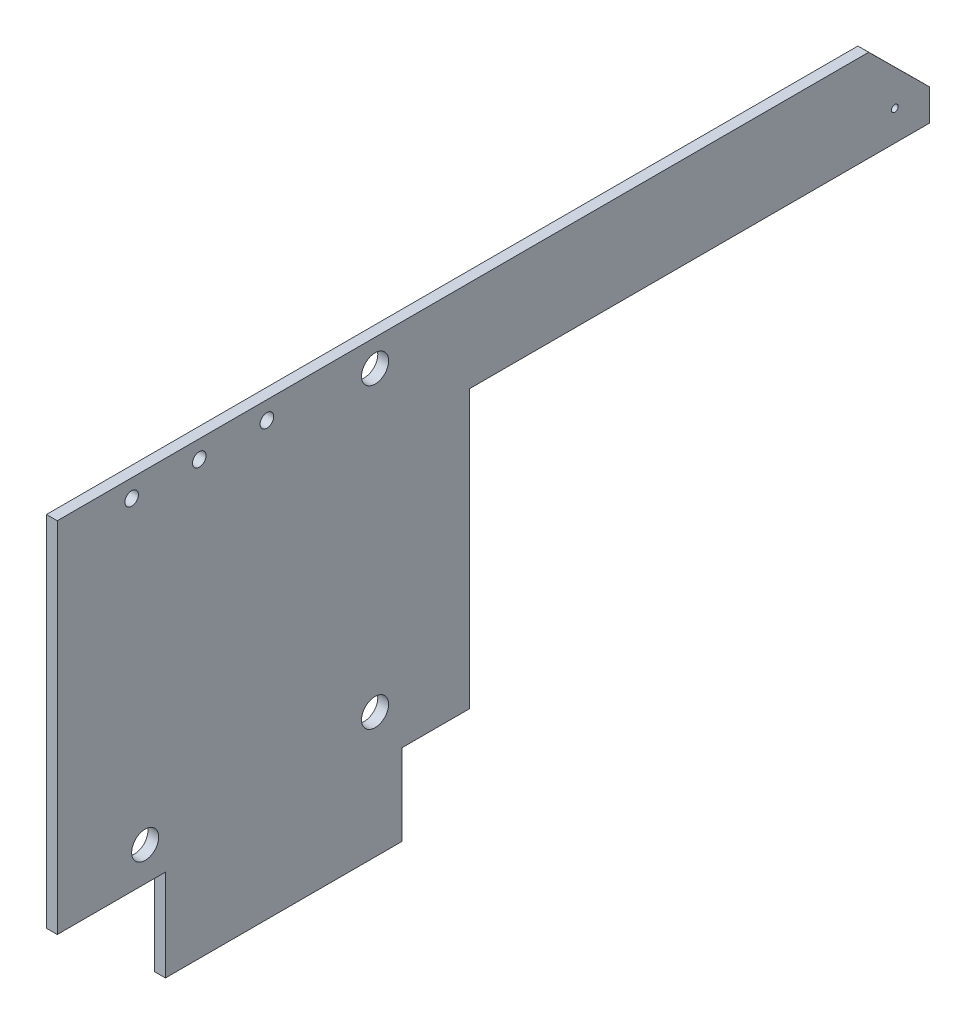
from build123d import *

# Parameters (mm, degrees)
SKETCH1_R           = 2
SKETCH1_R_2         = 1
SKETCH1_R_3         = 0.5
BOSS_EXTRUDE1_DEPTH = 1.6


with BuildPart() as part:
    # Sketch1 → Boss-Extrude1 (new body)
    with BuildSketch(Plane(origin=(0, 0, 0), x_dir=(0, 0, -1), z_dir=(1, 0, 0))):
        Polygon((3, 11), (3, 64), (123, 64), (132, 55.063430305), (132, 50.423430305), (64, 50.423430305), (64, 9.436073979), (54, 9.436073979), (54, -2.563926021), (19, -2.563926021), (19, 11), align=None)
        with Locations((16, 16)):
            Circle(SKETCH1_R, mode=Mode.SUBTRACT)
        with Locations((50, 16)):
            Circle(SKETCH1_R, mode=Mode.SUBTRACT)
        with Locations((50, 60)):
            Circle(SKETCH1_R, mode=Mode.SUBTRACT)
        with Locations((14, 61.35)):
            Circle(SKETCH1_R_2, mode=Mode.SUBTRACT)
        with Locations((24, 61.35)):
            Circle(SKETCH1_R_2, mode=Mode.SUBTRACT)
        with Locations((34, 61.35)):
            Circle(SKETCH1_R_2, mode=Mode.SUBTRACT)
        with Locations((126.861808856, 54.882900864)):
            Circle(SKETCH1_R_3, mode=Mode.SUBTRACT)
    extrude(amount=BOSS_EXTRUDE1_DEPTH)


solid = part.part
